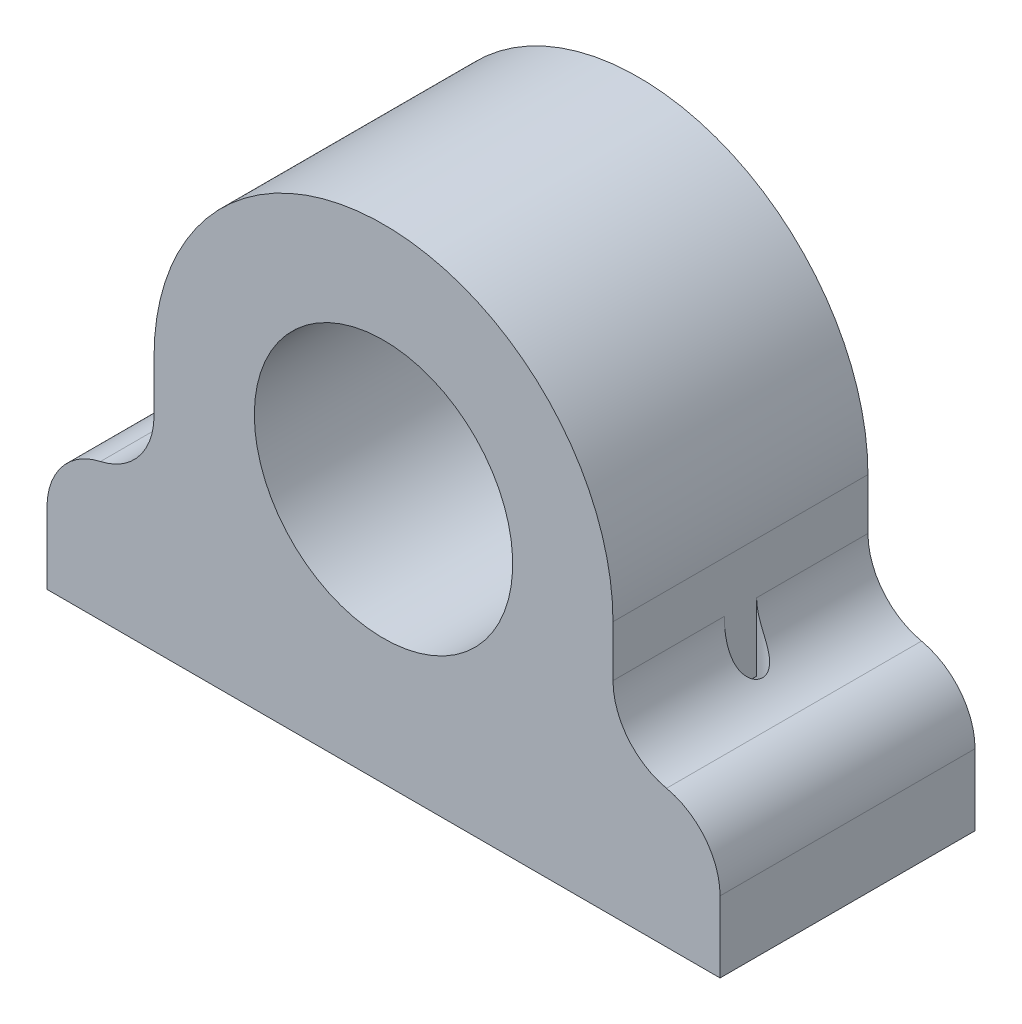
from build123d import *

# Parameters (mm, degrees)
BOSS_EXTRUDE1_DEPTH = 9.525
SKETCH11_R          = 6.4135
CUT_EXTRUDE7_DEPTH  = 1.5875
SKETCH12_R          = 4.826
CUT_EXTRUDE8_DEPTH  = 23.464106648
SKETCH13_R          = 0.635
CUT_EXTRUDE9_DEPTH  = 25.720183808
FILLET1_R           = 2.54
SKETCH15_W          = 8.472670481
SKETCH15_H          = 13.323689659
SKETCH15_W_2        = 7.661730679
CUT_EXTRUDE10_DEPTH = 28.733584143
FILLET2_R           = 2.54


with BuildPart() as part:
    # Sketch10 → Boss-Extrude1 (new body)
    with BuildSketch(Plane.XY):
        with BuildLine():
            Line((-8.5725, 0), (-8.5725, -4.445))
            Line((-8.5725, -4.445), (-18.7325, -4.445))
            Line((-18.7325, -4.445), (-18.7325, -9.525))
            Line((-18.7325, -9.525), (18.7325, -9.525))
            Line((18.7325, -9.525), (18.7325, -4.445))
            Line((18.7325, -4.445), (8.5725, -4.445))
            Line((8.5725, -4.445), (8.5725, 0))
            ThreePointArc((8.5725, 0), (0, 8.5725), (-8.5725, 0))
        make_face()
    extrude(amount=BOSS_EXTRUDE1_DEPTH)

    # Sketch11 → Cut-Extrude7 (cut)
    with BuildSketch(Plane(origin=(0, 0, 0), x_dir=(-1, 0, 0), z_dir=(0, 0, -1))):
        Circle(SKETCH11_R)
    extrude(amount=-CUT_EXTRUDE7_DEPTH, mode=Mode.SUBTRACT)

    # Sketch12 → Cut-Extrude8 (cut, through all)
    with BuildSketch(Plane(origin=(0, 0, 1.5875), x_dir=(-1, 0, 0), z_dir=(0, 0, -1))):
        Circle(SKETCH12_R)
    extrude(amount=-CUT_EXTRUDE8_DEPTH, mode=Mode.SUBTRACT)

    # Sketch13 → Cut-Extrude9 (cut, through all)
    with BuildSketch(Plane(origin=(0, -4.445, 0), x_dir=(1, 0, 0), z_dir=(0, 1, 0))):
        with Locations(Location((-8.763, -4.7625, 0), (0, 0, 180))):
            Circle(SKETCH13_R)
        with Locations(Location((8.763, -4.7625, 0), (0, 0, 180))):
            Circle(SKETCH13_R)
    extrude(amount=-CUT_EXTRUDE9_DEPTH, mode=Mode.SUBTRACT)

    # Fillet1
    # the kernel refuses this fillet: 2.54 mm, written as the material it adds along each edge
    with BuildSketch(Plane(origin=(8.5725, -4.445, 0), x_dir=(0, 1, 0), z_dir=(0, 0, 1))) as fillet1_piece_1_section:
        with BuildLine():
            CenterArc((FILLET1_R, -FILLET1_R), FILLET1_R, 90, 90)
            Line((0, -FILLET1_R), (0, 0))
            Line((0, 0), (FILLET1_R, 0))
        make_face()
    fillet1_piece_1 = extrude(amount=10.506748607, mode=Mode.PRIVATE)
    fillet1_piece_1 = split(fillet1_piece_1, bisect_by=Plane(origin=(8.63691398, -2.568331275, 9.525), z_dir=(0, 0, -1)), keep=Keep.TOP, mode=Mode.PRIVATE)
    fillet1_piece_1 = fillet1_piece_1 - Plane(origin=(8.763, -2.568331275, 4.7625), x_dir=(-1, 0, 0), z_dir=(0, 1, 0)) * Cylinder(0.635, 32, mode=Mode.PRIVATE)
    add(fillet1_piece_1)
    with BuildSketch(Plane(origin=(-8.5725, -4.445, -0.981748607), x_dir=(0, 1, 0), z_dir=(0, 0, 1))) as fillet1_piece_2_section:
        with BuildLine():
            CenterArc((FILLET1_R, FILLET1_R), FILLET1_R, 180, 90)
            Line((0, FILLET1_R), (0, 0))
            Line((0, 0), (FILLET1_R, 0))
        make_face()
    fillet1_piece_2 = extrude(amount=10.506748607, mode=Mode.PRIVATE)
    fillet1_piece_2 = split(fillet1_piece_2, bisect_by=Plane(origin=(-8.636913982, -2.568331274, 0), z_dir=(0, 0, 1)), keep=Keep.TOP, mode=Mode.PRIVATE)
    fillet1_piece_2 = fillet1_piece_2 - Plane(origin=(-8.763, -2.568331274, 4.7625), x_dir=(-1, 0, 0), z_dir=(0, 1, 0)) * Cylinder(0.635, 32, mode=Mode.PRIVATE)
    add(fillet1_piece_2)
    # the kernel refuses this fillet: 2.54 mm, written as the material it takes off along each edge
    with BuildSketch(Plane(origin=(18.7325, -4.445, -6.35), x_dir=(-1, 0, 0), z_dir=(0, 0, 1)), Plane(origin=(-18.7325, -4.445, -6.35), x_dir=(0, -1, 0), z_dir=(0, 0, 1))) as fillet1_2_piece_1:
        with BuildLine():
            CenterArc((FILLET1_R, FILLET1_R), FILLET1_R, 180, 90)
            Line((0, FILLET1_R), (0, 0))
            Line((0, 0), (FILLET1_R, 0))
        make_face()
    extrude(amount=22.225, mode=Mode.SUBTRACT)

    # Sketch15 → Cut-Extrude10 (cut, through all)
    with BuildSketch(Plane.XZ.offset(9.525)):
        with Locations((-16.809335241, 4.995083112)):
            Rectangle(SKETCH15_W, SKETCH15_H)
        with Locations((16.40386534, 4.995083112)):
            Rectangle(SKETCH15_W_2, SKETCH15_H)
    extrude(amount=-CUT_EXTRUDE10_DEPTH, mode=Mode.SUBTRACT)

    # Fillet2
    fillet2_edges = [part.edges().sort_by_distance(p)[0] for p in [
        (12.573, -4.445, 4.7625),
        (-12.573, -4.445, 4.7625),
    ]]
    fillet(fillet2_edges, radius=FILLET2_R)


solid = part.part
